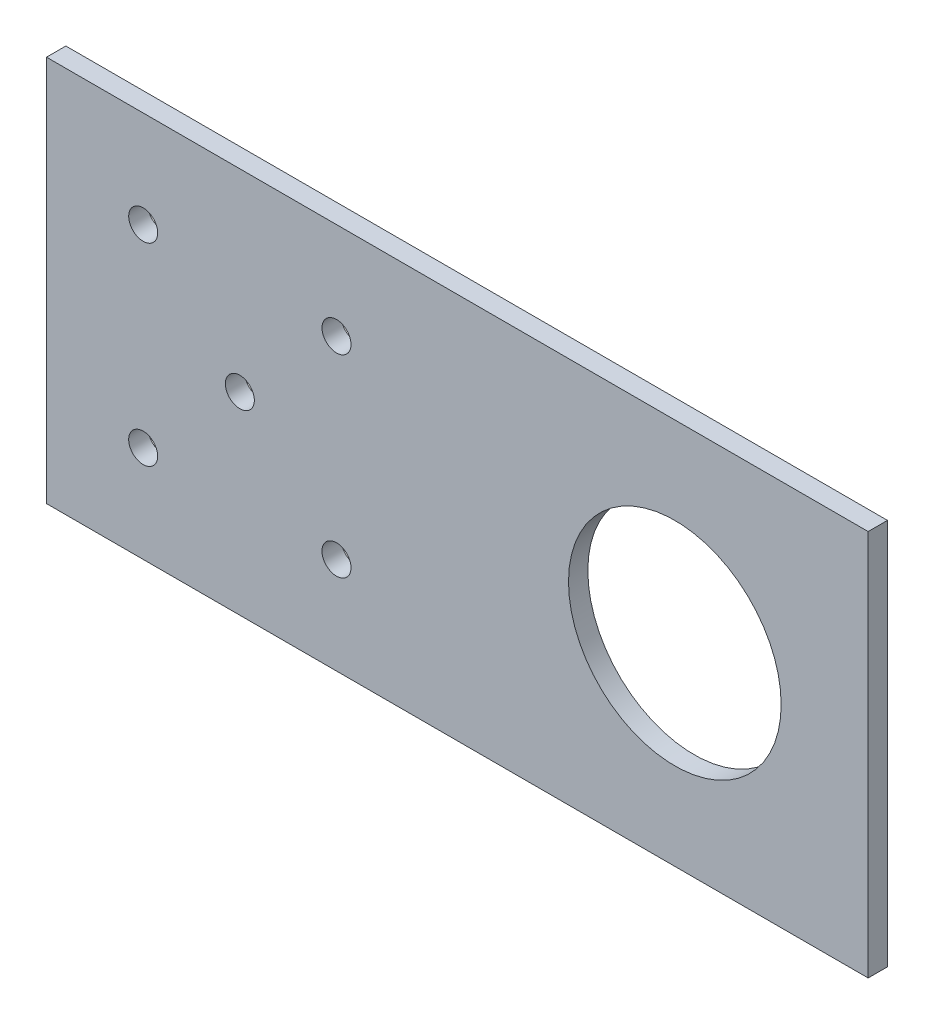
from build123d import *

# Parameters (mm, degrees)
SKETCH1_W           = 85
SKETCH1_H           = 40
BOSS_EXTRUDE1_DEPTH = 1
SKETCH2_R           = 11
SKETCH2_R_2         = 1.5
CUT_EXTRUDE1_DEPTH  = 2


with BuildPart() as part:
    # Sketch1 → Boss-Extrude1 (new, symmetric)
    with BuildSketch(Plane.XY):
        Rectangle(SKETCH1_W, SKETCH1_H)
    extrude(amount=BOSS_EXTRUDE1_DEPTH, both=True)

    # Sketch2 → Cut-Extrude1 (cut)
    with BuildSketch(Plane.XY.offset(1)):
        with Locations((22.5, 0)):
            Circle(SKETCH2_R)
        with Locations((-22.5, 0)):
            Circle(SKETCH2_R_2)
        with Locations((-32.5, 10)):
            Circle(SKETCH2_R_2)
        with Locations((-12.5, 10)):
            Circle(SKETCH2_R_2)
        with Locations((-12.5, -10)):
            Circle(SKETCH2_R_2)
        with Locations((-32.5, -10)):
            Circle(SKETCH2_R_2)
    extrude(amount=-CUT_EXTRUDE1_DEPTH, mode=Mode.SUBTRACT)


solid = part.part
